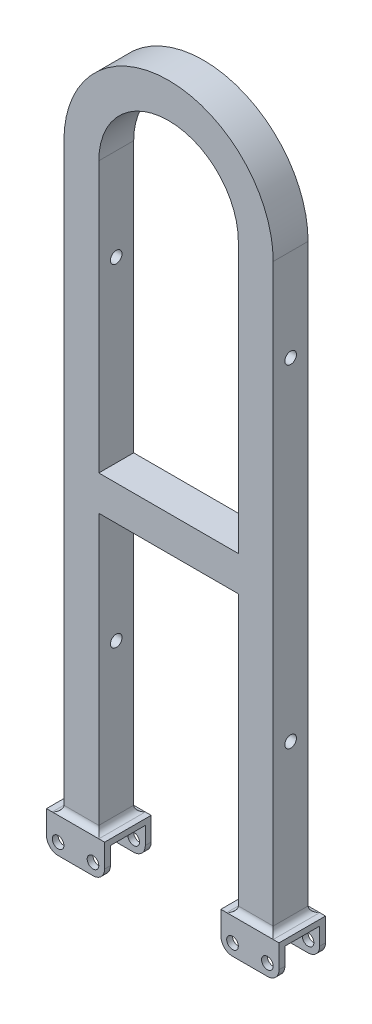
from build123d import *

# Parameters (mm, degrees)
SKETCH1_R               = 5
BOSS_EXTRUDE1_DEPTH     = 50
SKETCH2_W               = 30
SKETCH2_H               = 30
CUT_EXTRUDE1_DEPTH      = 639.479639456
SKETCH3_W               = 30
SKETCH3_H               = 30
SKETCH3_W_2             = 5
SKETCH3_H_2             = 35
CUT_EXTRUDE2_DEPTH      = 642.526499842
FILLET1_R               = 5
SKETCH4_R               = 5
CUT_EXTRUDE3_DEPTH      = 639.10755363
SKETCH5_W               = 30
SKETCH5_H               = 30
BOSS_EXTRUDE2_DEPTH     = 120
SKETCH6_W               = 41.881061045
SKETCH6_H               = 38.598384764
CUT_EXTRUDE4_DEPTH      = 642.156182221
SKETCH7_W               = 50
SKETCH7_H               = 40
BOSS_EXTRUDE3_DEPTH     = 30
SKETCH8_R               = 5
CUT_EXTRUDE5_DEPTH      = 617.973459721
FILLET2_R               = 10
SKETCH9_W               = 30
SKETCH9_H               = 25
CUT_EXTRUDE6_DEPTH      = 642.156182221
CUT_EXTRUDE7_DEPTH      = 639.10755363
CUT_EXTRUDE7_DEPTH_BACK = 639.10755363
SKETCH10_R              = 5


with BuildPart() as part:
    # Sketch1 → Boss-Extrude1 (new body)
    with BuildSketch(Plane.XY):
        with BuildLine():
            Line((90, 17.5), (90, 517.5))
            ThreePointArc((90, 517.5), (0, 607.5), (-90, 517.5))
            Line((-90, 517.5), (-90, 17.5))
            Line((-90, 17.5), (-100, 17.5))
            Line((-100, 17.5), (-100, -7.5))
            ThreePointArc((-100, -7.5), (-97.071067812, -14.571067812), (-90, -17.5))
            Line((-90, -17.5), (-60, -17.5))
            ThreePointArc((-60, -17.5), (-52.928932188, -14.571067812), (-50, -7.5))
            Line((-50, -7.5), (-50, 17.5))
            Line((-50, 17.5), (-60, 17.5))
            Line((-60, 17.5), (-60, 517.5))
            ThreePointArc((-60, 517.5), (0, 577.5), (60, 517.5))
            Line((60, 517.5), (60, 17.5))
            Line((60, 17.5), (50, 17.5))
            Line((50, 17.5), (50, -7.5))
            ThreePointArc((50, -7.5), (52.928932188, -14.571067812), (60, -17.5))
            Line((60, -17.5), (90, -17.5))
            ThreePointArc((90, -17.5), (97.071067812, -14.571067812), (100, -7.5))
            Line((100, -7.5), (100, 17.5))
            Line((100, 17.5), (90, 17.5))
        make_face()
        with Locations((90, -7.5)):
            Circle(SKETCH1_R, mode=Mode.SUBTRACT)
        with Locations((60, -7.5)):
            Circle(SKETCH1_R, mode=Mode.SUBTRACT)
        with Locations((-90, -7.5)):
            Circle(SKETCH1_R, mode=Mode.SUBTRACT)
        with Locations((-60, -7.5)):
            Circle(SKETCH1_R, mode=Mode.SUBTRACT)
    extrude(amount=BOSS_EXTRUDE1_DEPTH)

    # Sketch2 → Cut-Extrude1 (cut, through all)
    with BuildSketch(Plane(origin=(90, 0, 0), x_dir=(0, 0, -1), z_dir=(1, 0, 0))):
        with BuildLine():
            Line((-50, 17.5), (-45, 17.5))
            ThreePointArc((-45, 17.5), (-41.464466094, 18.964466094), (-40, 22.5))
            Line((-40, 22.5), (-40, 607.5))
            Line((-40, 607.5), (-50, 607.5))
            Line((-50, 607.5), (-50, 17.5))
        make_face()
        with Locations((-25, -2.5)):
            Rectangle(SKETCH2_W, SKETCH2_H)
        with BuildLine():
            Line((-5, 17.5), (0, 17.5))
            Line((0, 17.5), (0, 607.5))
            Line((0, 607.5), (-10, 607.5))
            Line((-10, 607.5), (-10, 22.5))
            ThreePointArc((-10, 22.5), (-8.535533906, 18.964466094), (-5, 17.5))
        make_face()
    extrude(amount=-CUT_EXTRUDE1_DEPTH, mode=Mode.SUBTRACT)

    # Sketch3 → Cut-Extrude2 (cut, through all)
    with BuildSketch(Plane(origin=(100, 0, 0), x_dir=(0, 0, -1), z_dir=(1, 0, 0))):
        with Locations((-25, -2.5)):
            Rectangle(SKETCH3_W, SKETCH3_H)
        with Locations((-47.5, 0)):
            Rectangle(SKETCH3_W_2, SKETCH3_H_2)
        with Locations((-2.5, 0)):
            Rectangle(SKETCH3_W_2, SKETCH3_H_2)
    extrude(amount=-CUT_EXTRUDE2_DEPTH, mode=Mode.SUBTRACT)

    # Fillet1
    # the kernel refuses this fillet: 5 mm, written as the material it adds along each edge
    with BuildSketch(Plane(origin=(-90, 17.5, 5), x_dir=(-1, 0, 0), z_dir=(0, 0, 1))) as fillet1_piece_1_section:
        with BuildLine():
            CenterArc((FILLET1_R, -FILLET1_R), FILLET1_R, 90, 90)
            Line((0, -FILLET1_R), (0, 0))
            Line((0, 0), (FILLET1_R, 0))
        make_face()
    fillet1_piece_1 = extrude(amount=40, mode=Mode.PRIVATE)
    fillet1_piece_1 = fillet1_piece_1 - Plane(origin=(-91.427889151, 22.5, 45), x_dir=(0, -1, 0), z_dir=(1, 0, 0)) * Cylinder(5, 101, mode=Mode.PRIVATE)
    fillet1_piece_1 = fillet1_piece_1 - Plane(origin=(-91.427889151, 22.5, 5), x_dir=(0, 0, 1), z_dir=(1, 0, 0)) * Cylinder(5, 101, mode=Mode.PRIVATE)
    add(fillet1_piece_1)
    with BuildSketch(Plane(origin=(60, 17.5, 5), x_dir=(-1, 0, 0), z_dir=(0, 0, 1))) as fillet1_piece_2_section:
        with BuildLine():
            CenterArc((FILLET1_R, -FILLET1_R), FILLET1_R, 90, 90)
            Line((0, -FILLET1_R), (0, 0))
            Line((0, 0), (FILLET1_R, 0))
        make_face()
    fillet1_piece_2 = extrude(amount=40, mode=Mode.PRIVATE)
    fillet1_piece_2 = fillet1_piece_2 - Plane(origin=(58.572110849, 22.5, 5), x_dir=(0, 0, 1), z_dir=(1, 0, 0)) * Cylinder(5, 101, mode=Mode.PRIVATE)
    fillet1_piece_2 = fillet1_piece_2 - Plane(origin=(58.572110849, 22.5, 45), x_dir=(0, -1, 0), z_dir=(1, 0, 0)) * Cylinder(5, 101, mode=Mode.PRIVATE)
    add(fillet1_piece_2)
    with BuildSketch(Plane(origin=(-60, 17.5, 5), x_dir=(1, 0, 0), z_dir=(0, 0, 1))) as fillet1_piece_3_section:
        with BuildLine():
            CenterArc((FILLET1_R, FILLET1_R), FILLET1_R, 180, 90)
            Line((0, FILLET1_R), (0, 0))
            Line((0, 0), (FILLET1_R, 0))
        make_face()
    fillet1_piece_3 = extrude(amount=40, mode=Mode.PRIVATE)
    fillet1_piece_3 = fillet1_piece_3 - Plane(origin=(-58.572110849, 22.5, 45), x_dir=(0, -1, 0), z_dir=(1, 0, 0)) * Cylinder(5, 101, mode=Mode.PRIVATE)
    fillet1_piece_3 = fillet1_piece_3 - Plane(origin=(-58.572110849, 22.5, 5), x_dir=(0, 0, 1), z_dir=(1, 0, 0)) * Cylinder(5, 101, mode=Mode.PRIVATE)
    add(fillet1_piece_3)
    with BuildSketch(Plane(origin=(90, 17.5, 5), x_dir=(0, 1, 0), z_dir=(0, 0, 1))) as fillet1_piece_4_section:
        with BuildLine():
            CenterArc((FILLET1_R, -FILLET1_R), FILLET1_R, 90, 90)
            Line((0, -FILLET1_R), (0, 0))
            Line((0, 0), (FILLET1_R, 0))
        make_face()
    fillet1_piece_4 = extrude(amount=40, mode=Mode.PRIVATE)
    fillet1_piece_4 = fillet1_piece_4 - Plane(origin=(91.427889151, 22.5, 5), x_dir=(0, 0, 1), z_dir=(1, 0, 0)) * Cylinder(5, 101, mode=Mode.PRIVATE)
    fillet1_piece_4 = fillet1_piece_4 - Plane(origin=(91.427889151, 22.5, 45), x_dir=(0, -1, 0), z_dir=(1, 0, 0)) * Cylinder(5, 101, mode=Mode.PRIVATE)
    add(fillet1_piece_4)

    # Sketch4 → Cut-Extrude3 (cut, through all)
    with BuildSketch(Plane(origin=(90, 0, 0), x_dir=(0, 0, -1), z_dir=(1, 0, 0))):
        with Locations(Location((-25, 152.5, 0), (0, 0, 90))):
            Circle(SKETCH4_R)
    extrude(amount=-CUT_EXTRUDE3_DEPTH, mode=Mode.SUBTRACT)

    # Sketch5 → Boss-Extrude2 (add)
    with BuildSketch(Plane(origin=(-60, 0, 0), x_dir=(0, 0, -1), z_dir=(1, 0, 0))):
        with Locations((-25, 270)):
            Rectangle(SKETCH5_W, SKETCH5_H)
    extrude(amount=BOSS_EXTRUDE2_DEPTH)

    # Sketch6 → Cut-Extrude4 (cut, through all)
    with BuildSketch(Plane(origin=(100, 0, 0), x_dir=(0, 0, -1), z_dir=(1, 0, 0))):
        with Locations((-24.059469477, -1.799192382)):
            Rectangle(SKETCH6_W, SKETCH6_H)
    extrude(amount=-CUT_EXTRUDE4_DEPTH, mode=Mode.SUBTRACT)

    # Sketch7 → Boss-Extrude3 (add)
    with BuildSketch(Plane.XZ.offset(-17.5)):
        with Locations((-75, 25)):
            Rectangle(SKETCH7_W, SKETCH7_H)
        with Locations((75, 25)):
            Rectangle(SKETCH7_W, SKETCH7_H)
    extrude(amount=BOSS_EXTRUDE3_DEPTH)

    # Sketch8 → Cut-Extrude5 (cut, through all)
    with BuildSketch(Plane.XY.offset(45)):
        with Locations((-90, -2.5)):
            Circle(SKETCH8_R)
        with Locations((-60, -2.5)):
            Circle(SKETCH8_R)
        with Locations((60, -2.5)):
            Circle(SKETCH8_R)
        with Locations((90, -2.5)):
            Circle(SKETCH8_R)
    extrude(amount=-CUT_EXTRUDE5_DEPTH, mode=Mode.SUBTRACT)

    # Fillet2
    fillet2_edges = [part.edges().sort_by_distance(p)[0] for p in [
        (-100, -12.5, 25),
        (-50, -12.5, 25),
        (50, -12.5, 25),
        (100, -12.5, 25),
    ]]
    fillet(fillet2_edges, radius=FILLET2_R)

    # Sketch9 → Cut-Extrude6 (cut, through all)
    with BuildSketch(Plane.ZY.offset(100)):
        with Locations((25, 0)):
            Rectangle(SKETCH9_W, SKETCH9_H)
    extrude(amount=-CUT_EXTRUDE6_DEPTH, mode=Mode.SUBTRACT)

    # Sketch10 → Cut-Extrude7 (cut, two sides: drawn at the far end of the back side and taken through both)
    with BuildSketch(Plane.ZY.offset(90).offset(-CUT_EXTRUDE7_DEPTH_BACK)):
        with Locations(Location((25, 438.296527551, 0), (0, 0, 270))):
            Circle(SKETCH10_R)
    extrude(amount=CUT_EXTRUDE7_DEPTH + CUT_EXTRUDE7_DEPTH_BACK, mode=Mode.SUBTRACT)


solid = part.part
